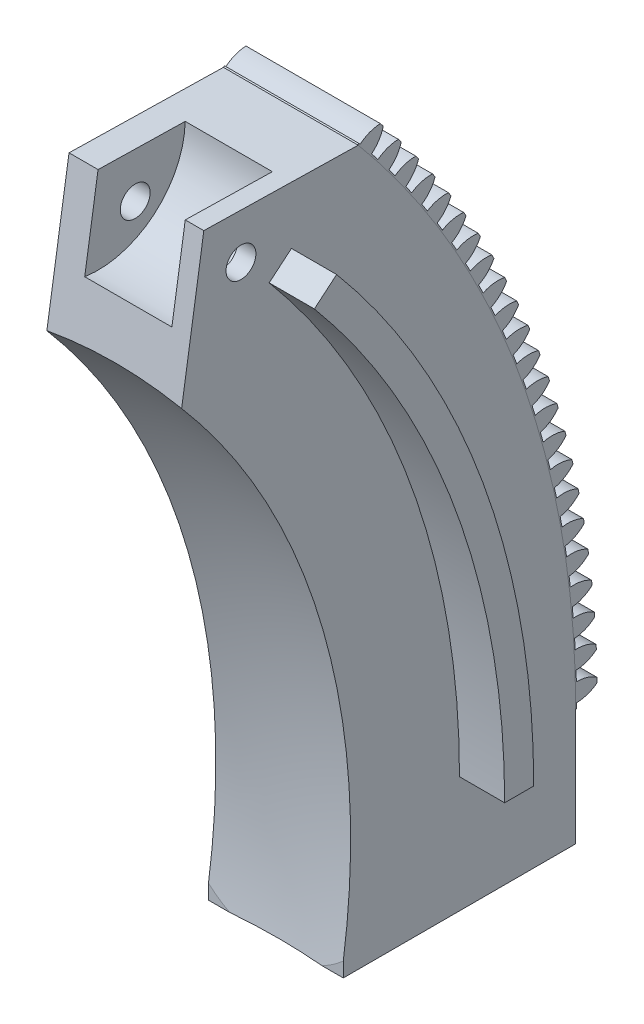
from build123d import *

# Parameters (mm, degrees)
BOSS_EXTRUDE2_DEPTH     = 6.35
BOSS_EXTRUDE3_START     = 29.464
BOSS_EXTRUDE3_DEPTH     = 29.464
CUT_EXTRUDE4_DEPTH      = 6.35
CIRPATTERN3_COUNT       = 100
CIRPATTERN3_ANGLE       = 173.009708738
CUT_EXTRUDE7_DEPTH      = 248.520050541
CUT_EXTRUDE7_DEPTH_BACK = 248.520050541
SKETCH15_R              = 3.2639
BOSS_EXTRUDE4_DEPTH     = 9.87425
SKETCH24_W              = 19.05
SKETCH24_H              = 19.05
SKETCH25_W              = 6.35
SKETCH25_H              = 6.35
BOSS_EXTRUDE5_DEPTH     = 4.7625
FILLET3_R               = 2.54
BOSS_EXTRUDE6_START     = 23.01875
BOSS_EXTRUDE6_DEPTH     = 23.01875


with BuildPart() as part:
    # Sketch11 → Boss-Extrude2 (new body)
    with BuildSketch(Plane(origin=(6.35, 0, 0), x_dir=(0, 0, -1), z_dir=(1, 0, 0))):
        with BuildLine():
            ThreePointArc((155.660230842, 130.614442288), (190.945540544, 69.498493124), (203.2, 0))
            Line((203.2, 0), (208.000006656, 0))
            ThreePointArc((208.000006656, 0), (195.456071378, 71.140192088), (159.337249268, 133.699827093))
            Line((159.337249268, 133.699827093), (155.660230842, 130.614442288))
        make_face()
    extrude(amount=-BOSS_EXTRUDE2_DEPTH)

    # Sketch1 → Boss-Extrude3 (add)
    with BuildSketch(Plane(origin=(0, 0, 0), x_dir=(0, 0, -1), z_dir=(1, 0, 0)).offset(BOSS_EXTRUDE3_START)):
        with BuildLine():
            Line((152.4, 0), (152.4, -25.4))
            Line((152.4, -25.4), (203.2, -25.4))
            Line((203.2, -25.4), (203.2, 0))
            ThreePointArc((203.2, 0), (190.945540544, 69.498493124), (155.660230842, 130.614442288))
            Line((155.660230842, 130.614442288), (121.916747361, 131.312974751))
            Line((121.916747361, 131.312974751), (116.745173131, 97.960831716))
            ThreePointArc((116.745173131, 97.960831716), (143.209155408, 52.123869843), (152.4, 0))
        make_face()
    extrude(amount=-BOSS_EXTRUDE3_DEPTH)

    # Sketch12 → Cut-Extrude4 (cut)
    with BuildSketch(Plane(origin=(6.35, 0, 0), x_dir=(0, 0, -1), z_dir=(1, 0, 0))):
        with BuildLine():
            ThreePointArc((203.496905889, 1.123362858), (206.492077476, 1.772772167), (208.969392364, 3.577126965))
            ThreePointArc((208.969392364, 3.577126965), (208.992352943, 1.788628983), (209.000006656, 0))
            ThreePointArc((209.000006656, 0), (208.992352943, -1.788628983), (208.969392364, -3.577126965))
            ThreePointArc((208.969392364, -3.577126965), (206.492077476, -1.772772167), (203.496905889, -1.123362858))
            ThreePointArc((203.496905889, -1.123362858), (203.500006512, 0), (203.496905889, 1.123362858))
        make_face()
    cut_extrude4 = extrude(amount=-CUT_EXTRUDE4_DEPTH, mode=Mode.SUBTRACT)

    # CirPattern3: Cut-Extrude4 ×100 about axis
    cirpattern3_axis = Axis((0, 0, 0), (1, 0, 0))
    for i in range(1, CIRPATTERN3_COUNT):
        add(cut_extrude4.rotate(cirpattern3_axis, i * CIRPATTERN3_ANGLE / (CIRPATTERN3_COUNT - 1)), mode=Mode.SUBTRACT)

    # Sketch15 → Cut-Extrude7 (cut, two sides: drawn at the far end of the back side and taken through both)
    with BuildSketch(Plane(origin=(6.35, 0, 0), x_dir=(0, 0, -1), z_dir=(1, 0, 0)).offset(-CUT_EXTRUDE7_DEPTH_BACK)):
        with Locations((130.034688148, 121.259308419)):
            Circle(SKETCH15_R)
    extrude(amount=CUT_EXTRUDE7_DEPTH + CUT_EXTRUDE7_DEPTH_BACK, mode=Mode.SUBTRACT)

    # Sketch21 → Cut-Revolve7 (revolve, cut)
    with BuildSketch(Plane(origin=(0, 0, 0), x_dir=(1, 0, 0), z_dir=(0, 1, 0))):
        with BuildLine():
            Line((-76.177622652, 38.1), (-102.108, 38.1))
            ThreePointArc((-102.108, 38.1), (14.732, 154.94), (131.572, 38.1))
            Line((131.572, 38.1), (105.641622652, 38.1))
            Line((105.641622652, 38.1), (-76.177622652, 38.1))
        make_face()
    revolve(axis=Axis((-1000, 0, 0), (1, 0, 0)), mode=Mode.SUBTRACT)

    # Sketch23 → Boss-Extrude4 (add)
    with BuildSketch(Plane(origin=(0, 0, 0), x_dir=(0, 0, -1), z_dir=(1, 0, 0))):
        with BuildLine():
            Line((177.8, 0), (184.15, 0))
            ThreePointArc((184.15, 0), (173.044396118, 62.983009393), (141.0670842, 118.369338324))
            Line((141.0670842, 118.369338324), (136.202701987, 114.287637002))
            ThreePointArc((136.202701987, 114.287637002), (167.077347976, 60.811181483), (177.8, 0))
        make_face()
    boss_extrude4 = extrude(amount=-BOSS_EXTRUDE4_DEPTH)

    # Mirror2: Boss-Extrude4 across plane
    add(boss_extrude4.mirror(Plane(origin=(14.732, 0, 0), x_dir=(0, 0, 1), z_dir=(1, 0, 0))))

    # Sketch24 → Cut-Revolve8 (revolve, cut)
    with BuildSketch(Plane(origin=(0, -15.377424259, -99.170973978), x_dir=(1, 0, 0), z_dir=(0, 0.15322859214167278, 0.9881907703223508))):
        with Locations((15.875, 138.918401229)):
            Rectangle(SKETCH24_W, SKETCH24_H)
    revolve(axis=Axis((0, 131.312974751, -121.916747361), (1, 0, 0)), mode=Mode.SUBTRACT)

    # Sketch25 → Boss-Extrude5 (add)
    with BuildSketch(Plane(origin=(0, 0, -203.2), x_dir=(-1, 0, 0), z_dir=(0, 0, -1))):
        with Locations((-3.175, -6.35)):
            Rectangle(SKETCH25_W, SKETCH25_H)
    extrude(amount=BOSS_EXTRUDE5_DEPTH)

    # Fillet3
    fillet3_edges = [part.edges().sort_by_distance(p)[0] for p in [
        (3.175, -9.525, -203.2),
        (3.175, -3.175, -203.2),
        (6.35, -6.35, -203.2),
    ]]
    fillet(fillet3_edges, radius=FILLET3_R)

    # Sketch27 → Boss-Extrude6 (add)
    with BuildSketch(Plane(origin=(6.35, 0, 0), x_dir=(0, 0, -1), z_dir=(1, 0, 0)).offset(BOSS_EXTRUDE6_START)):
        with BuildLine():
            Line((155.890049163, 130.807282757), (155.660230842, 130.614442288))
            ThreePointArc((155.660230842, 130.614442288), (190.945540544, 69.498493124), (203.2, 0))
            Line((203.2, 0), (203.500006512, 0))
            ThreePointArc((203.500006512, 0), (203.499231355, 0.561683569), (203.496905889, 1.123362858))
            ThreePointArc((203.496905889, 1.123362858), (205.866335368, 1.525623714), (207.982945717, 2.664030709))
            ThreePointArc((207.982945717, 2.664030709), (207.975819197, 3.171970697), (207.967452178, 3.679891766))
            ThreePointArc((207.967452178, 3.679891766), (205.817109245, 4.753220759), (203.436514411, 5.083035991))
            ThreePointArc((203.436514411, 5.083035991), (203.405355326, 6.205970912), (203.36799788, 7.328716719))
            ThreePointArc((203.36799788, 7.328716719), (205.724057883, 7.803049001), (207.804966708, 9.005475015))
            ThreePointArc((207.804966708, 9.005475015), (207.782353278, 9.51296142), (207.758500503, 10.020391085))
            ThreePointArc((207.758500503, 10.020391085), (205.576425306, 11.02764363), (203.186879623, 11.284706433))
            ThreePointArc((203.186879623, 11.284706433), (203.121489817, 12.406168826), (203.049910298, 13.527253166))
            ThreePointArc((203.049910298, 13.527253166), (205.390409142, 14.073215637), (207.433680713, 15.338542133))
            ThreePointArc((207.433680713, 15.338542133), (207.395601409, 15.845102875), (207.356285067, 16.351569108))
            ThreePointArc((207.356285067, 16.351569108), (205.144507443, 17.291808226), (202.748233746, 17.475879472))
            ThreePointArc((202.748233746, 17.475879472), (202.648674045, 18.594826116), (202.54293904, 19.71320612))
            ThreePointArc((202.54293904, 19.71320612), (204.865699514, 20.330290907), (206.869433114, 21.657340837))
            ThreePointArc((206.869433114, 21.657340837), (206.815923358, 22.162504697), (206.761180022, 22.667536365))
            ThreePointArc((206.761180022, 22.667536365), (204.52175744, 23.539887415), (202.120984821, 23.650795875))
            ThreePointArc((202.120984821, 23.650795875), (201.987347839, 24.766185889), (201.847555705, 25.880821204))
            ThreePointArc((201.847555705, 25.880821204), (204.150417103, 26.568454274), (206.112748792, 27.955993173))
            ThreePointArc((206.112748792, 27.955993173), (206.043858361, 28.45929023), (205.973738955, 28.962417538))
            ThreePointArc((205.973738955, 28.962417538), (203.708754599, 29.76606903), (201.305716335, 29.803711534))
            ThreePointArc((201.305716335, 29.803711534), (201.138126386, 30.914507345), (200.964407163, 32.0243611))
            ThreePointArc((200.964407163, 32.0243611), (203.245227287, 32.781902795), (205.164331641, 34.228639929))
            ThreePointArc((205.164331641, 34.228639929), (205.080124619, 34.729602), (204.994694371, 35.230356922))
            ThreePointArc((204.994694371, 35.230356922), (202.706255202, 35.964561273), (200.303186679, 35.928902803))
            ThreePointArc((200.303186679, 35.928902803), (200.10179966, 37.034071114), (199.894314948, 38.138110887))
            ThreePointArc((199.894314948, 38.138110887), (202.150972104, 38.964856516), (204.025063908, 40.469446082))
            ThreePointArc((204.025063908, 40.469446082), (203.925618628, 40.967607156), (203.824957007, 41.465523873))
            ThreePointArc((203.824957007, 41.465523873), (201.515191808, 42.129598103), (199.114328438, 42.020671831))
            ThreePointArc((199.114328438, 42.020671831), (198.879331686, 43.119184577), (198.638274493, 44.216383353))
            ThreePointArc((198.638274493, 44.216383353), (200.868669465, 45.111563851), (202.696005379, 46.672606232))
            ThreePointArc((202.696005379, 46.672606232), (202.581414347, 47.167502903), (202.465614992, 47.662118237))
            ThreePointArc((202.465614992, 47.662118237), (200.136672382, 48.255444601), (197.740247527, 48.073351853))
            ThreePointArc((197.740247527, 48.073351853), (197.471859644, 49.164187162), (197.197454209, 50.253524292))
            ThreePointArc((197.197454209, 50.253524292), (199.399512211, 51.216306932), (201.178392386, 52.832349994))
            ThreePointArc((201.178392386, 52.832349994), (201.048762199, 53.323521893), (200.917932831, 53.814375736))
            ThreePointArc((200.917932831, 53.814375736), (198.571979268, 54.336402303), (196.182222161, 54.081312469))
            ThreePointArc((196.182222161, 54.081312469), (195.88069281, 55.16345561), (195.573194395, 56.243917756))
            ThreePointArc((195.573194395, 56.243917756), (197.744867, 57.273406927), (199.473636663, 58.942947374))
            ThreePointArc((199.473636663, 58.942947374), (199.329087908, 59.429937596), (199.183350228, 59.916573341))
            ThreePointArc((199.183350228, 59.916573341), (196.822567995, 60.366814505), (194.441701666, 60.038964877))
            ThreePointArc((194.441701666, 60.038964877), (194.10731134, 61.111409204), (193.767005989, 62.181991286))
            ThreePointArc((193.767005989, 62.181991286), (195.906273036, 63.277229323), (197.583324031, 64.998714094))
            ThreePointArc((197.583324031, 64.998714094), (197.42399117, 65.481069626), (197.263480748, 65.963034587))
            ThreePointArc((197.263480748, 65.963034587), (194.890065923, 66.341071518), (192.520305132, 65.940767073))
            ThreePointArc((192.520305132, 65.940767073), (192.153364891, 67.002514964), (191.780569168, 68.062221091))
            ThreePointArc((191.780569168, 68.062221091), (193.885440641, 69.222189168), (195.509212918, 70.994016881))
            ThreePointArc((195.509212918, 70.994016881), (195.33524417, 71.471289019), (195.160110318, 71.948134857))
            ThreePointArc((195.160110318, 71.948134857), (192.776270728, 72.253615894), (190.419819905, 71.781229008))
            ThreePointArc((190.419819905, 71.781229008), (190.020671088, 72.831292791), (189.61573178, 73.879137189))
            ThreePointArc((189.61573178, 73.879137189), (191.684249659, 75.102756265), (193.253232733, 76.923278708))
            ThreePointArc((193.253232733, 76.923278708), (193.064789927, 77.395023479), (192.875195561, 77.866306616))
            ThreePointArc((192.875195561, 77.866306616), (190.483148732, 78.09894759), (188.142199924, 77.554917692))
            ThreePointArc((188.142199924, 77.554917692), (187.711213834, 78.592320563), (187.274507628, 79.627328493))
            ThreePointArc((187.274507628, 79.627328493), (189.304747709, 80.913460318), (190.81748206, 82.780983982))
            ThreePointArc((190.81748206, 82.780983982), (190.614740494, 83.246762552), (190.41086198, 83.712044586))
            ThreePointArc((190.41086198, 83.712044586), (188.012833073, 83.871629087), (185.689563906, 83.256462252))
            ThreePointArc((185.689563906, 83.256462252), (185.22714146, 84.280239185), (184.759074595, 85.301447849))
            ThreePointArc((184.759074595, 85.301447849), (186.749148282, 86.64889602), (188.204226716, 88.561683674))
            ThreePointArc((188.204226716, 88.561683674), (187.987374985, 89.021062761), (187.769401979, 89.479910871))
            ThreePointArc((187.769401979, 89.479910871), (185.367621717, 89.566290448), (183.064193374, 88.880558924))
            ThreePointArc((183.064193374, 88.880558924), (182.570764732, 89.889757567), (182.07177262, 90.896217003))
            ThreePointArc((182.07177262, 90.896217003), (184.019828682, 92.303728081), (185.415897636, 94.260000386))
            ThreePointArc((185.415897636, 94.260000386), (185.185137463, 94.712552661), (184.953272729, 95.164540011))
            ThreePointArc((184.953272729, 95.164540011), (182.549975329, 95.177634311), (180.268530534, 94.421975989))
            ThreePointArc((180.268530534, 94.421975989), (179.744554699, 95.415657553), (179.215101518, 96.40643152))
            ThreePointArc((179.215101518, 96.40643152), (181.119327809, 97.872696191), (182.455088615, 99.870633359))
            ThreePointArc((182.455088615, 99.870633359), (182.210634661, 100.315937843), (181.965093888, 100.76064398))
            ThreePointArc((181.965093888, 100.76064398), (179.562514975, 100.700440822), (177.305176002, 99.875558639))
            ThreePointArc((177.305176002, 99.875558639), (176.751140395, 100.852798769), (176.191718658, 101.826965616))
            ThreePointArc((176.191718658, 101.826965616), (178.050343805, 103.350619914), (179.324553894, 105.388363397))
            ThreePointArc((179.324553894, 105.388363397), (179.066633558, 105.826005854), (178.807645156, 106.263017097))
            ThreePointArc((178.807645156, 106.263017097), (176.408019688, 106.129572484), (174.176886388, 105.236233773))
            ThreePointArc((174.176886388, 105.236233773), (173.59330639, 106.196123408), (173.004436491, 107.152776934))
            ThreePointArc((173.004436491, 107.152776934), (174.81573154, 108.732403504), (176.0272056, 110.808057728))
            ThreePointArc((176.0272056, 110.808057728), (175.756058808, 111.237631047), (175.483863697, 111.666540875))
            ThreePointArc((175.483863697, 111.666540875), (173.089423883, 111.459978942), (170.886571729, 110.499014716))
            ThreePointArc((170.886571729, 110.499014716), (170.273990206, 111.440660935), (169.656219931, 112.378911229))
            ThreePointArc((169.656219931, 112.378911229), (171.418499956, 114.013040652), (172.566111034, 116.124674775))
            ThreePointArc((172.566111034, 116.124674775), (172.281990016, 116.545779353), (171.996841399, 116.96618878))
            ThreePointArc((171.996841399, 116.96618878), (169.609814626, 116.686701677), (167.437292784, 115.659005856))
            ThreePointArc((167.437292784, 115.659005856), (166.796279579, 116.58153271), (166.150183599, 117.50050698))
            ThreePointArc((166.150183599, 117.50050698), (167.861809268, 119.187619135), (168.944489819, 121.333268845))
            ThreePointArc((168.944489819, 121.333268845), (168.647658873, 121.745512958), (168.349822006, 122.157030904))
            ThreePointArc((168.349822006, 122.157030904), (165.972428765, 121.80487862), (163.832258185, 120.7114072))
            ThreePointArc((163.832258185, 120.7114072), (163.16340959, 121.613956524), (162.489588923, 122.512799911))
            ThreePointArc((162.489588923, 122.512799911), (164.148968027, 124.251325391), (165.165710906, 126.428994735))
            ThreePointArc((165.165710906, 126.428994735), (164.856446155, 126.831994899), (164.546198095, 127.234238558))
            ThreePointArc((164.546198095, 127.234238558), (162.180649914, 126.809748675), (160.074821454, 125.65151884))
            ThreePointArc((160.074821454, 125.65151884), (159.378759653, 126.533251052), (158.67784111, 127.411127423))
            ThreePointArc((158.67784111, 127.411127423), (160.28343004, 129.199448994), (161.23328944, 131.407112233))
            ThreePointArc((161.23328944, 131.407112233), (160.91187857, 131.800493565), (160.589507921, 132.193088755))
            ThreePointArc((160.589507921, 132.193088755), (158.238005311, 131.696656149), (156.168477881, 130.474745321))
            ThreePointArc((156.168477881, 130.474745321), (156.029352112, 130.641088214), (155.890049163, 130.807282757))
        make_face()
    extrude(amount=-BOSS_EXTRUDE6_DEPTH)


solid = part.part
